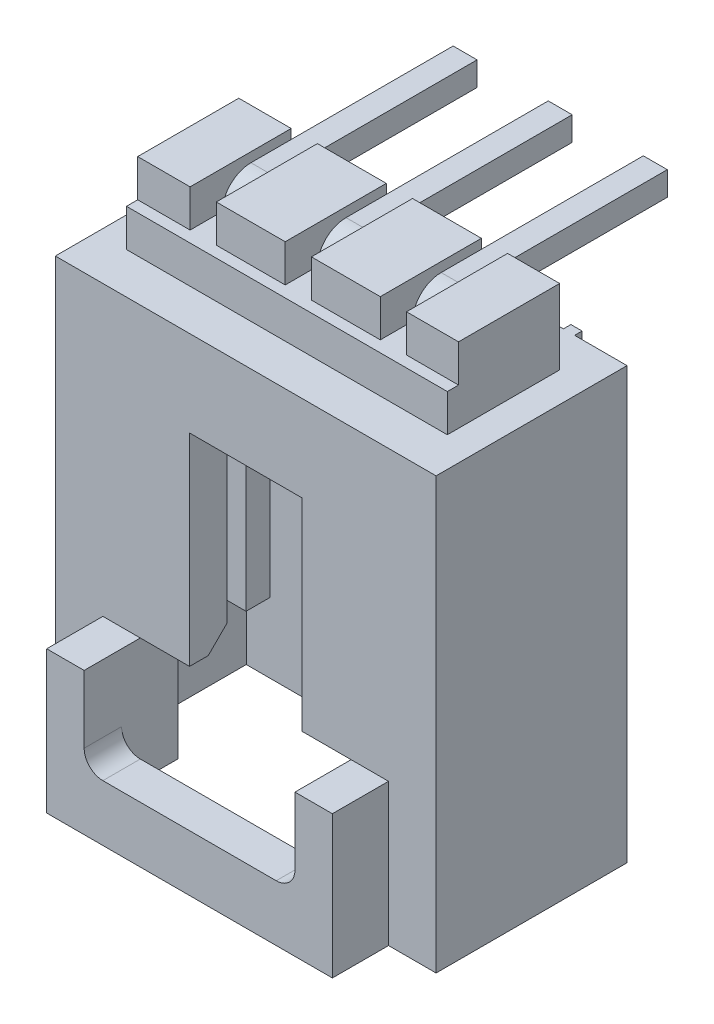
from build123d import *

# Parameters (mm, degrees)
EXTRUDE_START                      = 0.2
EXTRUDE_1_DEPTH                    = 5.1
SKETCH_7_W                         = 0.3
SKETCH_7_H                         = 0.2
EXTRUDE_4_DEPTH                    = 11.5
SKETCH_8_W                         = 1
SKETCH_8_H                         = 2
CUT_EXTRUDE_5_DEPTH                = 8.57
CUT_EXTRUDE_1_DEPTH                = 9.2
EXTRUDE_2_DEPTH                    = 3.8
SKETCH_4_W                         = 5.63
SKETCH_4_H                         = 1
CUT_EXTRUDE_2_DEPTH                = 3.8
CUT_EXTRUDE_3_REACH                = 17.485
CHAMFER_1_SIZE                     = 0.5
CUT_EXTRUDE_6_REACH                = 16.449
SKETCH_9_W                         = 0.7
SKETCH_9_H                         = 1
SWEEP_START                        = 2.22
SWEEP_1_DEPTH                      = 0.64
CHAMFER_2_SIZE                     = 0.2
PATTERN_LINEAR_2_COUNT             = 3
PATTERN_LINEAR_2_PITCH             = 2.54
PATTERN_LINEAR_1_COUNT             = 3
PATTERN_LINEAR_1_PITCH             = 2.54
CHAMFER_2_OF_PATTERN_LINEAR_1_SIZE = 0.2


# Read off the part's stored shape, not the designer's step: По траектории1
with BuildPart() as part:
    # Эскиз1 → Бобышка-Вытянуть1 (new body)
    with BuildSketch(Plane.XY.offset(EXTRUDE_START)):
        Polygon((-4.285, 0.55), (4.285, 0.55), (4.285, -1.45), (5.085, -1.45), (5.085, -12.95), (-5.085, -12.95), (-5.085, -1.45), (-4.285, -1.45), align=None)
    extrude(amount=EXTRUDE_1_DEPTH)

    # Эскиз7 → Бобышка-Вытянуть4 (add)
    with BuildSketch(Plane.XZ.offset(12.95)):
        with Locations((3.535, 0.1)):
            Rectangle(SKETCH_7_W, SKETCH_7_H)
        with Locations((-3.535, 0.1)):
            Rectangle(SKETCH_7_W, SKETCH_7_H)
    extrude(amount=-EXTRUDE_4_DEPTH)

    # Эскиз8 → Вырез-Вытянуть5 (cut)
    with BuildSketch(Plane(origin=(4.285, 0, 0), x_dir=(0, 0, -1), z_dir=(1, 0, 0))):
        with Locations((-0.7, -0.45)):
            Rectangle(SKETCH_8_W, SKETCH_8_H)
        Polygon((-4.2, -1.45), (-5.3, -1.45), (-5.3, 0.55), (-3.9, 0.55), (-3.9, -0.45), (-4.2, -0.45), align=None)
    extrude(amount=-CUT_EXTRUDE_5_DEPTH, mode=Mode.SUBTRACT)

    # Эскиз2 → Вырез-Вытянуть1 (cut)
    with BuildSketch(Plane.XZ.offset(12.95)):
        Polygon((-4.085, 4.3), (-4.085, 1.2), (0.67, 1.2), (0.67, 0.2), (1.87, 0.2), (1.87, 1.2), (4.085, 1.2), (4.085, 4.3), (1.5, 4.3), (1.5, 5.3), (-1.5, 5.3), (-1.5, 4.3), align=None)
    extrude(amount=-CUT_EXTRUDE_1_DEPTH, mode=Mode.SUBTRACT)

    # Эскиз3 → Бобышка-Вытянуть2 (add)
    with BuildSketch(Plane.XZ.offset(12.95)):
        Polygon((-3.815, 5.3), (-3.815, 6.8), (3.815, 6.8), (3.815, 5.3), (2.815, 5.3), (2.815, 5.8), (-2.815, 5.8), (-2.815, 5.3), align=None)
    extrude(amount=-EXTRUDE_2_DEPTH)

    # Эскиз4 → Вырез-Вытянуть2 (cut)
    with BuildSketch(Plane.XZ.offset(12.95)):
        with Locations((0, 4.8)):
            Rectangle(SKETCH_4_W, SKETCH_4_H)
    extrude(amount=-CUT_EXTRUDE_2_DEPTH, mode=Mode.SUBTRACT)

    # Эскиз5 → Вырез-Вытянуть3 (cut, up to next)
    with BuildSketch(Plane.XY.offset(6.8), mode=Mode.PRIVATE) as cut_extrude_3_sk1:
        with BuildLine():
            Line((2.815, -9.15), (2.815, -10.95))
            ThreePointArc((2.815, -10.95), (2.668553391, -11.303553391), (2.315, -11.45))
            Line((2.315, -11.45), (-2.315, -11.45))
            ThreePointArc((-2.315, -11.45), (-2.668553391, -11.303553391), (-2.815, -10.95))
            Line((-2.815, -10.95), (-2.815, -9.15))
            Line((-2.815, -9.15), (2.815, -9.15))
        make_face()
    cut_extrude_3_tool1 = extrude(cut_extrude_3_sk1.sketch, amount=-CUT_EXTRUDE_3_REACH, mode=Mode.PRIVATE) & part.part
    add(cut_extrude_3_tool1.solids().sort_by_distance((0, -10.291324, 6.8))[0], mode=Mode.SUBTRACT)

    # Фаска1
    chamfer_1_edges = [part.edges().sort_by_distance(p)[0] for p in [
        (-2.815, -12.95, 5.05),
        (0, -12.95, 5.8),
        (2.815, -12.95, 5.05),
        (2.1575, -9.15, 4.3),
        (-3.45, -12.95, 4.3),
        (-2.1575, -9.15, 4.3),
        (-4.085, -12.95, 2.75),
        (-1.7075, -12.95, 1.2),
        (2.9775, -12.95, 1.2),
        (4.085, -12.95, 2.75),
        (3.45, -12.95, 4.3),
    ]]
    chamfer(chamfer_1_edges, length=CHAMFER_1_SIZE)

    # Эскиз9 → Вырез-Вытянуть6 (cut, up to next)
    with BuildSketch(Plane.XY.offset(3.9), mode=Mode.PRIVATE) as cut_extrude_6_sk1:
        with Locations((2.545, 0.05)):
            Rectangle(SKETCH_9_W, SKETCH_9_H)
    cut_extrude_6_tool1 = extrude(cut_extrude_6_sk1.sketch, amount=-CUT_EXTRUDE_6_REACH, mode=Mode.PRIVATE) & part.part
    cut_extrude_6 = cut_extrude_6_tool1.solids().sort_by_distance((2.545, 0.05, 3.9))[0]
    add(cut_extrude_6, mode=Mode.SUBTRACT)

    # По траектории1 outline → По траектории1 (add)
    with BuildSketch(Plane.YZ.offset(SWEEP_START)):
        with BuildLine():
            Line((-3.75, 2.43), (-3.75, 3.07))
            add(Edge.make_bspline(
                [(-3.75, 3.07), (-4.166666667, 3.07), (-4.583333333, 3.07), (-6.516666667, 3.07), (-8.033333333, 3.07), (-9.55, 3.07)],
                knots=[0.623544277, 0.623544277, 0.623544277, 0.623544277, 0.704676976, 0.704676976, 1, 1, 1, 1], degree=3))
            Line((-9.55, 3.07), (-9.55, 2.43))
            Line((-9.55, 2.43), (-3.75, 2.43))
        make_face()
        with BuildLine():
            Line((0.32, -3.3), (0.32, 2.3))
            add(Edge.make_bspline(
                [(0.32, 2.3), (0.32, 2.499654349), (0.23877091, 2.700173533), (0.022322877, 2.916621566), (-0.064240468, 2.973940923), (-0.250203983, 3.050392149), (-0.370157621, 3.069944018), (-0.45, 3.07)],
                knots=[0.363474491, 0.363474491, 0.363474491, 0.363474491, 0.386414221, 0.386414221, 0.397884087, 0.397884087, 0.409353952, 0.409353952, 0.409353952, 0.409353952], degree=3))
            Line((-0.45, 3.07), (-0.45, 2.43))
            ThreePointArc((-0.45, 2.43), (-0.358076118, 2.391923882), (-0.32, 2.3))
            Line((-0.32, 2.3), (-0.32, -3.3))
            Line((-0.32, -3.3), (0.32, -3.3))
        make_face()
    sweep_1 = extrude(amount=SWEEP_1_DEPTH)

    # Фаска2
    chamfer_2_edges = [part.edges().sort_by_distance(p)[0] for p in [
        (2.54, -9.55, 3.07),
        (2.86, -9.55, 2.75),
        (2.54, -9.55, 2.43),
        (2.22, -9.55, 2.75),
        (2.54, -0.32, -3.3),
        (2.86, 0, -3.3),
        (2.54, 0.32, -3.3),
        (2.22, 0, -3.3),
    ]]
    chamfer(chamfer_2_edges, length=CHAMFER_2_SIZE)

    # Линейный массив2: Вырез-Вытянуть6 ×3
    with Locations(*[(-i * PATTERN_LINEAR_2_PITCH, 0, 0) for i in range(1, PATTERN_LINEAR_2_COUNT)]):
        add(cut_extrude_6, mode=Mode.SUBTRACT)

    # Линейный массив1: По траектории1 ×3
    with Locations(*[(-i * PATTERN_LINEAR_1_PITCH, 0, 0) for i in range(1, PATTERN_LINEAR_1_COUNT)]):
        add(sweep_1)

    # Фаска2 of Линейный массив1
    chamfer_2_of_pattern_linear_1_edges = [part.edges().sort_by_distance(p)[0] for p in [
        (0, -9.55, 3.07),
        (0.32, -9.55, 2.75),
        (0, -9.55, 2.43),
        (-0.32, -9.55, 2.75),
        (0, -0.32, -3.3),
        (0.32, 0, -3.3),
        (0, 0.32, -3.3),
        (-0.32, 0, -3.3),
        (-2.54, -9.55, 3.07),
        (-2.22, -9.55, 2.75),
        (-2.54, -9.55, 2.43),
        (-2.86, -9.55, 2.75),
        (-2.54, -0.32, -3.3),
        (-2.22, 0, -3.3),
        (-2.54, 0.32, -3.3),
        (-2.86, 0, -3.3),
    ]]
    chamfer(chamfer_2_of_pattern_linear_1_edges, length=CHAMFER_2_OF_PATTERN_LINEAR_1_SIZE)


solid = part.part
